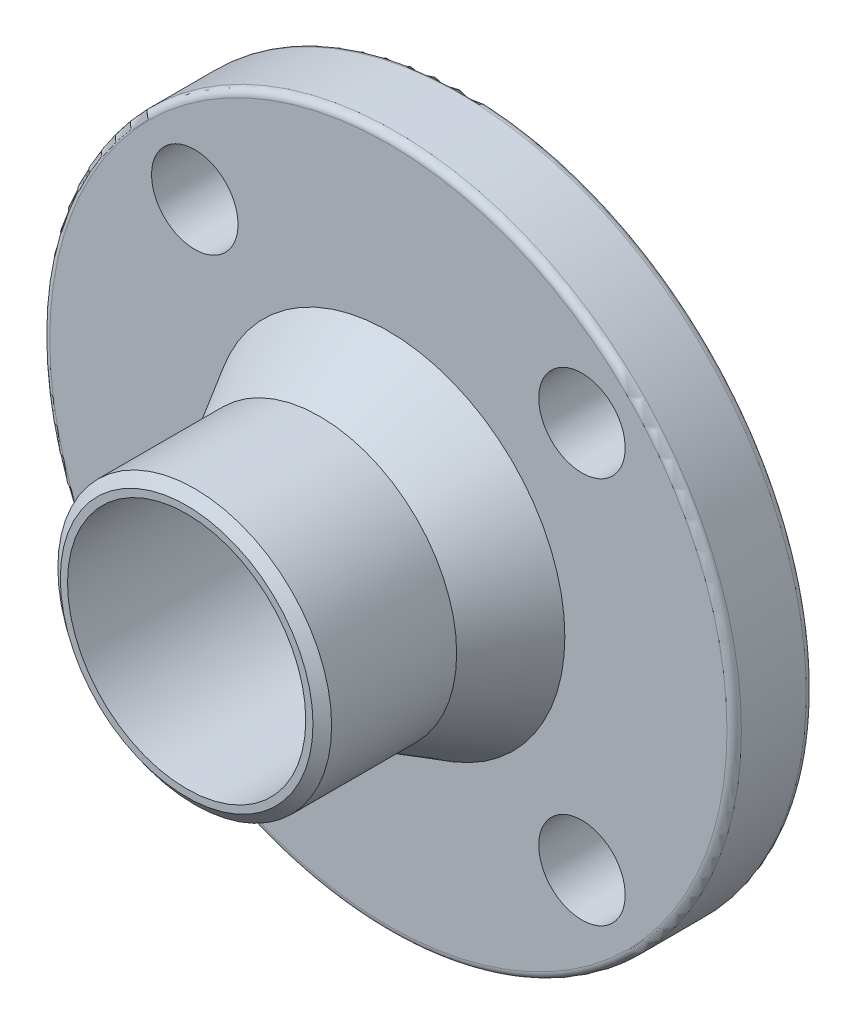
from build123d import *

# Parameters (mm, degrees)
SKETCH1_R                 = 76.2
BOSS_EXTRUDE1_DEPTH       = 19.05
SKETCH2_R                 = 9.525
BOLTHOLE_DEPTH            = 110.433918417
BOLTHOLEPATTERN_COUNT     = 4
SKETCH5_OUTSIDE_W         = 197.674
SKETCH5_OUTSIDE_H         = 197.674
SKETCH5_OUTSIDE_R         = 46.0375
RAISED_FACE_DEPTH         = 1.5875
SKETCH8_R                 = 38.8874
WELD_NECK_120_DRAFT_DEPTH = 44.45
WELD_NECK_120_DRAFT_TAPER = 30
WELD_NECK_END_REACH       = 127.08
SKETCH9_R                 = 30.1625
WELD_NECK_CHAMFER1_SIZE   = 1.783344653
WELD_NECK_CHAMFER1_SIZE2  = 2.3241
SKETCH7_R                 = 26.2509
BORE_DEPTH                = 126.080494083
FILLET2_R                 = 1.5875
FILLET3_R                 = 1.5875


with BuildPart() as part:
    # Sketch1 → Boss-Extrude1 (new body)
    with BuildSketch(Plane.XY):
        with Locations(Location((0, 0, 0), (0, 0, 180))):
            Circle(SKETCH1_R)
    extrude(amount=BOSS_EXTRUDE1_DEPTH)

    # Sketch2 → BoltHole (cut, through all)
    with BuildSketch(Plane.XY):
        with Locations(Location((42.656216575, 42.656216575, 0), (0, 0, 180))):
            Circle(SKETCH2_R)
    bolthole = extrude(amount=BOLTHOLE_DEPTH, mode=Mode.SUBTRACT)

    # BoltHolePattern: BoltHole ×4 about axis
    boltholepattern_axis = Axis((0, 0, 0), (0, 0, 1))
    for i in range(1, BOLTHOLEPATTERN_COUNT):
        add(bolthole.rotate(boltholepattern_axis, i * 360 / BOLTHOLEPATTERN_COUNT), mode=Mode.SUBTRACT)

    # Sketch5 outside → Raised Face (cut)
    with BuildSketch(Plane(origin=(0, 0, 0), x_dir=(-1, 0, 0), z_dir=(0, 0, -1))):
        Rectangle(SKETCH5_OUTSIDE_W, SKETCH5_OUTSIDE_H)
        Circle(SKETCH5_OUTSIDE_R, mode=Mode.SUBTRACT)
    extrude(amount=-RAISED_FACE_DEPTH, mode=Mode.SUBTRACT)

    # Sketch8 → Weld Neck 120 Draft (add)
    with BuildSketch(Plane.XY.offset(19.05)):
        Circle(SKETCH8_R)
    extrude(amount=WELD_NECK_120_DRAFT_DEPTH, taper=WELD_NECK_120_DRAFT_TAPER)

    # Sketch9 → Weld Neck End (add, up to next)
    with BuildSketch(Plane.XY.offset(63.5), mode=Mode.PRIVATE) as weld_neck_end_sk1:
        Circle(SKETCH9_R)
    weld_neck_end_tool1 = extrude(weld_neck_end_sk1.sketch, amount=-WELD_NECK_END_REACH, mode=Mode.PRIVATE) - part.part
    add(weld_neck_end_tool1.solids().sort_by_distance((0, 0, 63.5))[0])

    # Weld Neck Chamfer1
    weld_neck_chamfer1_edges = [part.edges().sort_by_distance(p)[0] for p in [
        (-30.1625, 0, 63.5),
    ]]
    weld_neck_chamfer1_side = [part.faces().sort_by_distance(p)[0] for p in [
        (-30.1625, 0, 48.830985045),
    ]]
    chamfer(weld_neck_chamfer1_edges, length=WELD_NECK_CHAMFER1_SIZE, length2=WELD_NECK_CHAMFER1_SIZE2, reference=weld_neck_chamfer1_side[0])

    # Sketch7 → Bore (cut, through all)
    with BuildSketch(Plane.XY):
        Circle(SKETCH7_R)
    extrude(amount=BORE_DEPTH, mode=Mode.SUBTRACT)

    # Fillet2
    fillet2_edges = [part.edges().sort_by_distance(p)[0] for p in [
        (76.2, 0, 1.5875),
        (76.2, 0, 19.05),
    ]]
    fillet(fillet2_edges, radius=FILLET2_R)

    # Fillet3
    fillet3_edges = [part.edges().sort_by_distance(p)[0] for p in [
        (46.0375, 0, 1.5875),
    ]]
    fillet(fillet3_edges, radius=FILLET3_R - 0.0001)  # a hair under: the kernel refuses the full size


solid = part.part
